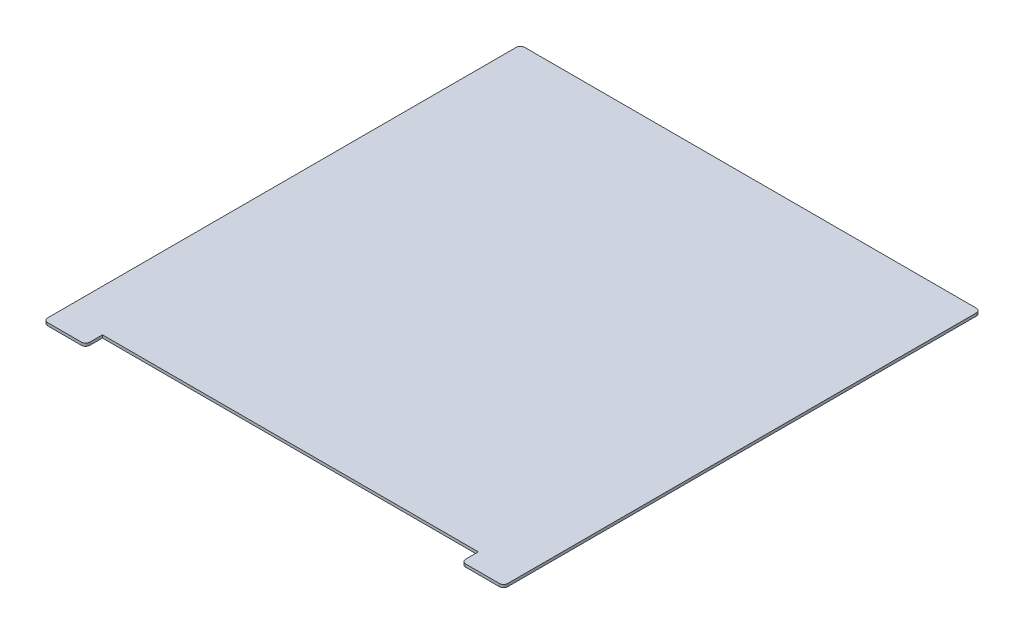
from build123d import *

# Parameters (mm, degrees)
BOSS_EXTRUDE1_DEPTH = 2
FILLET1_R           = 3


with BuildPart() as part:
    # Sketch1 → Boss-Extrude1 (new body)
    with BuildSketch(Plane(origin=(0, 0, 0), x_dir=(1, 0, 0), z_dir=(0, 1, 0))):
        Polygon((-268, -197.649746193), (-268, -185.649746193), (0, -185.649746193), (0, -197.649746193), (30, -197.649746193), (30, 142.350253807), (-298, 142.350253807), (-298, -197.649746193), align=None)
    extrude(amount=BOSS_EXTRUDE1_DEPTH)

    # Fillet1
    fillet1_edges = [part.edges().sort_by_distance(p)[0] for p in [
        (30, 1, -142.350253807),
        (-298, 1, -142.350253807),
        (-268, 1, 197.649746193),
        (-298, 1, 197.649746193),
        (30, 1, 197.649746193),
        (0, 1, 197.649746193),
    ]]
    fillet(fillet1_edges, radius=FILLET1_R)


solid = part.part
